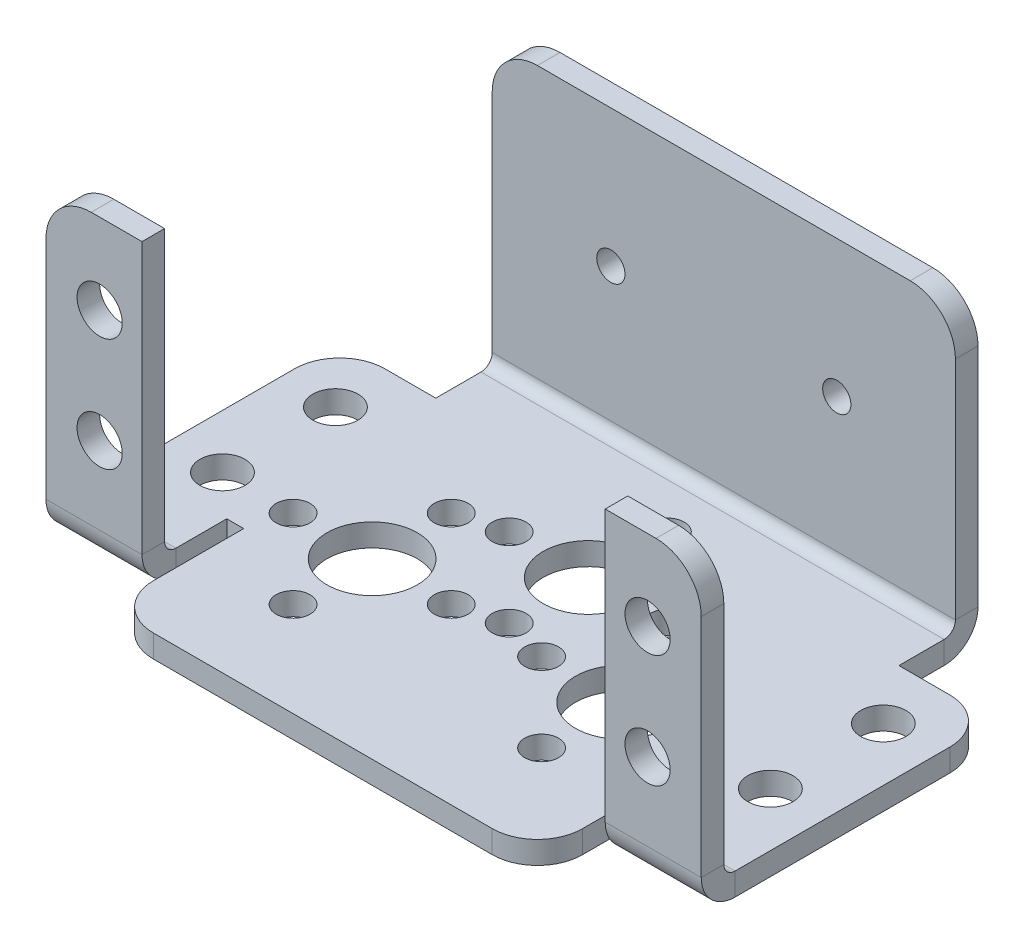
from build123d import *

# Parameters (mm, degrees)
T_LE_DE_BASE_PLI_E1_DEPTH             = 20.5
ESQUISSE8_W                           = 24
ESQUISSE8_H                           = 2
BOSS_EXTRU_1_DEPTH                    = 8.5
T_LE_PLI_E_SUR_AR_TE1_STRIP_W         = 10
T_LE_PLI_E_SUR_AR_TE1_STRIP_H         = 2
T_LE_PLI_E_SUR_AR_TE1_STRIP_CUT_DEPTH = 8.5
T_LE_PLI_E_SUR_AR_TE1_DEPTH           = 8.5
ESQUISSE12_W                          = 1.5
ESQUISSE12_H                          = 12
ENL_V_MAT_EXTRU_1_DEPTH               = 8.5
DIAM_TRE_DU_PER_AGE_4_0_4_1_D         = 4
DIAM_TRE_DU_PER_AGE_4_0_4_2_D         = 4
DIAM_TRE_DU_PER_AGE_2_5_2_5_2_D       = 2.5
CONG_1_R                              = 4
SKETCH1_R                             = 4
SKETCH1_R_2                           = 1.5
CUT_EXTRUDE1_DEPTH                    = 10


# Sheet-metal steps are written as plain solids
with BuildPart() as part:
    # Esquisse1 → Tôle de base pliée1 (new body)
    with BuildSketch(Plane(origin=(0, 0, 0), x_dir=(0, 0, -1), z_dir=(1, 0, 0))):
        with BuildLine():
            Line((0, 27), (0, 3))
            ThreePointArc((0, 3), (-0.878679656, 0.878679656), (-3, 0))
            Line((-3, 0), (-37.5, 0))
            Line((-37.5, 0), (-37.5, 2))
            Line((-37.5, 2), (-3, 2))
            ThreePointArc((-3, 2), (-2.292893219, 2.292893219), (-2, 3))
            Line((-2, 3), (-2, 27))
            Line((-2, 27), (0, 27))
        make_face()
    extrude(amount=T_LE_DE_BASE_PLI_E1_DEPTH)

    # Esquisse8 → Boss.-Extru.1 (add)
    with BuildSketch(Plane(origin=(20.5, 0, 0), x_dir=(0, 0, -1), z_dir=(1, 0, 0))):
        with Locations((-19, 1)):
            Rectangle(ESQUISSE8_W, ESQUISSE8_H)
    extrude(amount=BOSS_EXTRU_1_DEPTH)

    # Tôle pliée sur arête1 strip (across the edge) → Tôle pliée sur arête1 strip cut (cut)
    with BuildSketch(Plane(origin=(20.5, 2, 31), x_dir=(0, 0, -1), z_dir=(1, 0, 0))):
        with Locations((-4, -1)):
            Rectangle(T_LE_PLI_E_SUR_AR_TE1_STRIP_W, T_LE_PLI_E_SUR_AR_TE1_STRIP_H)
    extrude(amount=T_LE_PLI_E_SUR_AR_TE1_STRIP_CUT_DEPTH, mode=Mode.SUBTRACT)

    # Tôle pliée sur arête1 section (across the edge) → Tôle pliée sur arête1 (add)
    with BuildSketch(Plane(origin=(20.5, 2, 31), x_dir=(0, 0, -1), z_dir=(1, 0, 0))):
        with BuildLine():
            Line((-2, 1), (-2, 25))
            Line((-2, 25), (0, 25))
            Line((0, 25), (0, 1))
            ThreePointArc((0, 1), (0.292893219, 0.292893219), (1, 0))
            Line((1, 0), (1, -2))
            ThreePointArc((1, -2), (-1.121320344, -1.121320344), (-2, 1))
        make_face()
    extrude(amount=T_LE_PLI_E_SUR_AR_TE1_DEPTH)

    # Esquisse12 → Enlèv. mat.-Extru.1 (cut)
    with BuildSketch(Plane(origin=(0, 2, 0), x_dir=(1, 0, 0), z_dir=(0, 1, 0))):
        with Locations((19.75, -31.5)):
            Rectangle(ESQUISSE12_W, ESQUISSE12_H)
    extrude(amount=-ENL_V_MAT_EXTRU_1_DEPTH, mode=Mode.SUBTRACT)

    # Diamètre du perçage Ø4.0 (4)1 (through all)
    with Locations(Plane(origin=(0, 2, 0), x_dir=(1, 0, 0), z_dir=(0, 1, 0))):
        with Locations((24.25, -12.13), (24.25, -22.13)):
            Hole(DIAM_TRE_DU_PER_AGE_4_0_4_1_D / 2)

    # Diamètre du perçage Ø4.0 (4)2 (through all)
    with Locations(Plane.XY.offset(33)):
        with Locations((24.25, 19.87), (24.25, 9.87)):
            Hole(DIAM_TRE_DU_PER_AGE_4_0_4_2_D / 2)

    # Diamètre du perçage Ø2.5 (2.5)2 (through all)
    with Locations(Plane.XY.offset(2)):
        with Locations((10, 14.87)):
            Hole(DIAM_TRE_DU_PER_AGE_2_5_2_5_2_D / 2)

    # Congé1
    cong_1_edges = [part.edges().sort_by_distance(p)[0] for p in [
        (20.5, 27, 1),
        (29, 1, 7),
        (29, 27, 32),
        (19, 1, 37.5),
    ]]
    fillet(cong_1_edges, radius=CONG_1_R)

    # Symétrie1: part across plane


with BuildPart() as part_1:
    add(part.part)
    add(part.part.mirror(Plane(origin=(0, 3, 3), x_dir=(0, 0, 1), z_dir=(1, 0, 0))))

    # Sketch1 → Cut-Extrude1 (cut)
    with BuildSketch(Plane.XZ):
        with Locations(Location((0, 14, 0), (0, 0, 270))):
            Circle(SKETCH1_R)
        with Locations(Location((11, 22.13, 0), (0, 0, 270))):
            Circle(SKETCH1_R)
        with Locations(Location((-11, 22.13, 0), (0, 0, 270))):
            Circle(SKETCH1_R)
        with Locations(Location((4, 22.13, 0), (0, 0, 270))):
            Circle(SKETCH1_R_2)
        with Locations(Location((11, 29.13, 0), (0, 0, 270))):
            Circle(SKETCH1_R_2)
        with Locations(Location((18, 22.13, 0), (0, 0, 270))):
            Circle(SKETCH1_R_2)
        with Locations(Location((11, 15.13, 0), (0, 0, 270))):
            Circle(SKETCH1_R_2)
        with Locations(Location((-18, 22.13, 0), (0, 0, 270))):
            Circle(SKETCH1_R_2)
        with Locations(Location((0, 7, 0), (0, 0, 270))):
            Circle(SKETCH1_R_2)
        with Locations(Location((-11, 29.13, 0), (0, 0, 270))):
            Circle(SKETCH1_R_2)
        with Locations(Location((-4, 22.13, 0), (0, 0, 270))):
            Circle(SKETCH1_R_2)
        with Locations(Location((-11, 15.13, 0), (0, 0, 270))):
            Circle(SKETCH1_R_2)
        with Locations(Location((-7, 14, 0), (0, 0, 270))):
            Circle(SKETCH1_R_2)
        with Locations(Location((0, 21, 0), (0, 0, 270))):
            Circle(SKETCH1_R_2)
        with Locations(Location((7, 14, 0), (0, 0, 270))):
            Circle(SKETCH1_R_2)
    extrude(amount=-CUT_EXTRUDE1_DEPTH, mode=Mode.SUBTRACT)


solid = part_1.part
